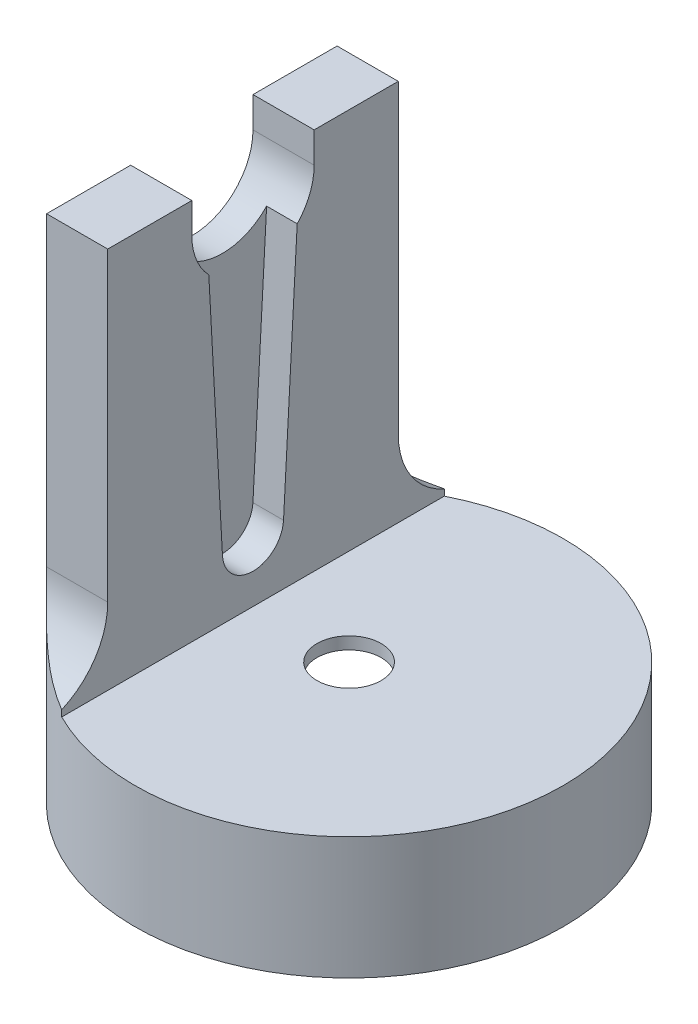
from build123d import *

# Parameters (mm, degrees)
SKETCH1_R           = 14
BOSS_EXTRUDE1_DEPTH = 8
SHELL1_T            = -0.8
SKETCH2_R           = 2.1
CUT_EXTRUDE1_DEPTH  = 2
SKETCH3_W           = 4
SKETCH3_H           = 19
BOSS_EXTRUDE2_DEPTH = 25
CUT_EXTRUDE2_DEPTH  = 19
SKETCH4_3_R         = 2
CUT_EXTRUDE3_DEPTH  = 2
FILLET1_R           = 5
FILLET2_R           = 5
CUT_EXTRUDE4_DEPTH  = 20


with BuildPart() as part:
    # Sketch1 → Boss-Extrude1 (new body)
    with BuildSketch(Plane(origin=(0, 0, 0), x_dir=(1, 0, 0), z_dir=(0, 1, 0))):
        with Locations(Location((0, 0, 0), (0, 0, 270))):
            Circle(SKETCH1_R)
    extrude(amount=-BOSS_EXTRUDE1_DEPTH)

    # Shell1
    shell1_openings = [part.faces().sort_by_distance(p)[0] for p in [
        (0, -8, 0),
    ]]
    offset(amount=SHELL1_T, openings=shell1_openings, kind=Kind.INTERSECTION)

    # Sketch2 → Cut-Extrude1 (cut)
    with BuildSketch(Plane(origin=(0, 0, 0), x_dir=(1, 0, 0), z_dir=(0, 1, 0))):
        with Locations(Location((0, 0, 0), (0, 0, 270))):
            Circle(SKETCH2_R)
    extrude(amount=-CUT_EXTRUDE1_DEPTH, mode=Mode.SUBTRACT)

    # Sketch3 → Boss-Extrude2 (add)
    with BuildSketch(Plane(origin=(0, 0, 0), x_dir=(1, 0, 0), z_dir=(0, 1, 0))):
        with Locations((-8.283481901, 0)):
            Rectangle(SKETCH3_W, SKETCH3_H)
    extrude(amount=BOSS_EXTRUDE2_DEPTH)

    # Sketch4 → Cut-Extrude2 (cut)
    with BuildSketch(Plane(origin=(-6.283481901, 0, 0), x_dir=(0, 0, -1), z_dir=(1, 0, 0))):
        with BuildLine():
            ThreePointArc((-4, 23), (-3.712354677, 21.510562941), (-2.890788624, 20.235340684))
            ThreePointArc((-2.890788624, 20.235340684), (0, 19), (2.890788624, 20.235340684))
            ThreePointArc((2.890788624, 20.235340684), (3.712354677, 21.510562941), (4, 23))
            Line((4, 23), (4, 25))
            Line((4, 25), (-4, 25))
            Line((-4, 25), (-4, 23))
        make_face()
    extrude(amount=-CUT_EXTRUDE2_DEPTH, mode=Mode.SUBTRACT)

    # Sketch4<3> → Cut-Extrude3 (cut)
    with BuildSketch(Plane(origin=(-6.283481901, 0, 0), x_dir=(0, 0, -1), z_dir=(1, 0, 0))):
        with BuildLine():
            ThreePointArc((2.890788624, 20.235340684), (0, 19), (-2.890788624, 20.235340684))
            Line((-2.890788624, 20.235340684), (-1.997016436, 3.890796724))
            ThreePointArc((-1.997016436, 3.890796724), (-0.054622013, 5.99925397), (2, 4))
            ThreePointArc((2, 4), (1.99925397, 3.945377987), (1.997016436, 3.890796724))
            Line((1.997016436, 3.890796724), (2.890788624, 20.235340684))
        make_face()
        with Locations((0, 4)):
            Circle(SKETCH4_3_R)
    extrude(amount=-CUT_EXTRUDE3_DEPTH, mode=Mode.SUBTRACT)

    # Fillet1
    # the kernel refuses this fillet: 5 mm, written as the material it adds along each edge
    with BuildSketch(Plane(origin=(-10.283481901, 0, 9.5), x_dir=(-1, 0, 0), z_dir=(0, 0, -1))) as fillet1_piece_1_section:
        with BuildLine():
            CenterArc((FILLET1_R, FILLET1_R), FILLET1_R, 180, 90)
            Line((0, FILLET1_R), (0, 0))
            Line((0, 0), (FILLET1_R, 0))
        make_face()
    fillet1_piece_1 = extrude(amount=19, mode=Mode.PRIVATE)
    fillet1_piece_1 = fillet1_piece_1 & Plane(origin=(0, 1.284116868, 0), x_dir=(0, 0, 1), z_dir=(0, 1, 0)) * Cylinder(14, 58, mode=Mode.PRIVATE)
    add(fillet1_piece_1)

    # Fillet2
    # the kernel refuses this fillet: 5 mm, written as the material it adds along each edge
    with BuildSketch(Plane(origin=(-22.783481901, 0, -9.5), x_dir=(0, 1, 0), z_dir=(1, 0, 0))) as fillet2_piece_1_section:
        with BuildLine():
            CenterArc((FILLET2_R, -FILLET2_R), FILLET2_R, 90, 90)
            Line((0, -FILLET2_R), (0, 0))
            Line((0, 0), (FILLET2_R, 0))
        make_face()
    fillet2_piece_1 = extrude(amount=16.5, mode=Mode.PRIVATE)
    fillet2_piece_1 = fillet2_piece_1 & Plane(origin=(0, 1.41467333, 0), x_dir=(0, 0, 1), z_dir=(0, 1, 0)) * Cylinder(14, 53, mode=Mode.PRIVATE)
    add(fillet2_piece_1)
    with BuildSketch(Plane(origin=(-6.283481901, 0, 9.5), x_dir=(0, 1, 0), z_dir=(-1, 0, 0))) as fillet2_piece_2_section:
        with BuildLine():
            CenterArc((FILLET2_R, -FILLET2_R), FILLET2_R, 90, 90)
            Line((0, -FILLET2_R), (0, 0))
            Line((0, 0), (FILLET2_R, 0))
        make_face()
    fillet2_piece_2 = extrude(amount=16.5, mode=Mode.PRIVATE)
    fillet2_piece_2 = fillet2_piece_2 & Plane(origin=(0, 1.414673355, 0), x_dir=(0, 0, 1), z_dir=(0, 1, 0)) * Cylinder(14, 53, mode=Mode.PRIVATE)
    add(fillet2_piece_2)

    # Sketch5 → Cut-Extrude4 (cut)
    with BuildSketch(Plane.XY):
        with BuildLine():
            Line((-2, -3), (-2, -8))
            Line((-2, -8), (2, -8))
            Line((2, -8), (2, -3))
            ThreePointArc((2, -3), (0, -1), (-2, -3))
        make_face()
    extrude(amount=-CUT_EXTRUDE4_DEPTH, mode=Mode.SUBTRACT)


solid = part.part
